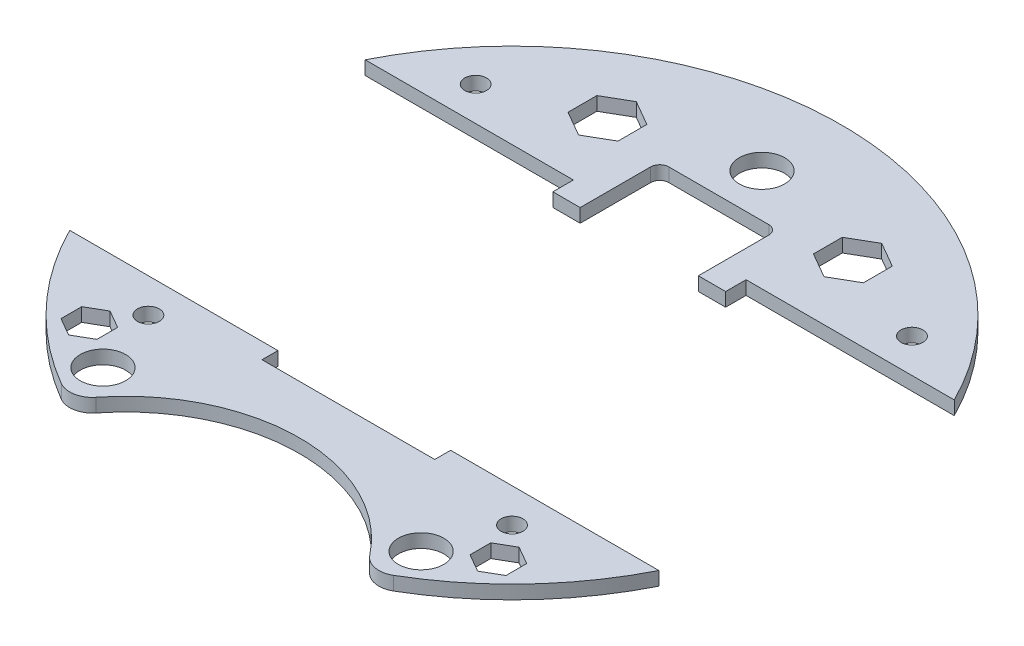
from build123d import *

# Parameters (mm, degrees)
BOSS_EXTRUDE1_DEPTH  = 3
SOLENOID_PLACEMENT_W = 38
SOLENOID_PLACEMENT_H = 64
CUT_EXTRUDE1_DEPTH   = 103.574363269
CUT_EXTRUDE5_DEPTH   = 103.574363269
SKETCH6_R            = 2.4
CUT_EXTRUDE6_DEPTH   = 103.574363269
CUT_EXTRUDE3_DEPTH   = 103.574363269
CUT_EXTRUDE7_DEPTH   = 98.289516393
SKETCH8_R            = 5
CUT_EXTRUDE9_DEPTH   = 98.289516393
SKETCH9_R            = 5
CUT_EXTRUDE11_DEPTH  = 98.289516393
CUT_EXTRUDE12_DEPTH  = 98.289516393


with BuildPart() as part:
    # Sketch1 → Boss-Extrude1 (new body)
    with BuildSketch(Plane(origin=(0, 0, 0), x_dir=(1, 0, 0), z_dir=(0, 1, 0))):
        with BuildLine():
            ThreePointArc((36.543377003, -62.616544118), (0, 72.5), (-36.543377003, -62.616544118))
            ThreePointArc((-36.543377003, -62.616544118), (-33.085954668, -63.20954405), (-30.089832649, -61.38507948))
            ThreePointArc((-30.089832649, -61.38507948), (0, -46.75), (30.089832649, -61.38507948))
            ThreePointArc((30.089832649, -61.38507948), (33.085954668, -63.20954405), (36.543377003, -62.616544118))
        make_face()
    extrude(amount=BOSS_EXTRUDE1_DEPTH)

    # solenoid placement → Cut-Extrude1 (cut, through all)
    with BuildSketch(Plane(origin=(0, 3, 0), x_dir=(1, 0, 0), z_dir=(0, 1, 0))):
        with Locations((0, -4)):
            Rectangle(SOLENOID_PLACEMENT_W, SOLENOID_PLACEMENT_H)
    extrude(amount=-CUT_EXTRUDE1_DEPTH, mode=Mode.SUBTRACT)

    # Sketch5 → Cut-Extrude5 (cut, through all)
    with BuildSketch(Plane(origin=(0, 3, 0), x_dir=(1, 0, 0), z_dir=(0, 1, 0))):
        Polygon((-21.5, 51.175426481), (-27, 54.350852961), (-32.5, 51.175426481), (-32.5, 44.824573519), (-27, 41.649147039), (-21.5, 44.824573519), align=None)
        Polygon((21.5, 51.175426481), (21.5, 44.824573519), (27, 41.649147039), (32.5, 44.824573519), (32.5, 51.175426481), (27, 54.350852961), align=None)
    extrude(amount=-CUT_EXTRUDE5_DEPTH, mode=Mode.SUBTRACT)

    # Sketch6 → Cut-Extrude6 (cut, through all)
    with BuildSketch(Plane(origin=(0, 3, 0), x_dir=(1, 0, 0), z_dir=(0, 1, 0))):
        with Locations((40, -40)):
            Circle(SKETCH6_R)
        with Locations((-40, -40)):
            Circle(SKETCH6_R)
        with Locations((48, 40)):
            Circle(SKETCH6_R)
        with Locations((-48, 40)):
            Circle(SKETCH6_R)
    extrude(amount=-CUT_EXTRUDE6_DEPTH, mode=Mode.SUBTRACT)

    # Sketch3 → Cut-Extrude3 (cut, through all)
    with BuildSketch(Plane(origin=(0, 3, 0), x_dir=(1, 0, 0), z_dir=(0, 1, 0))):
        Polygon((-19, 28), (-19, 32.5), (-72.5, 32.5), (-72.5, -32.5), (72.5, -32.5), (72.5, 32.5), (19, 32.5), (19, 28), align=None)
    extrude(amount=-CUT_EXTRUDE3_DEPTH, mode=Mode.SUBTRACT)


with BuildPart() as cut_extrude3_piece_1:
    # of the separate pieces the step leaves, piece 1, a body of its own (cut_extrude3_pieces)
    add(part.part.solids().sort_by_distance((64.807406984, 0, -32.5))[0])

    # Sketch7 → Cut-Extrude7 (cut, through all)
    with BuildSketch(Plane(origin=(0, 3, 0), x_dir=(1, 0, 0), z_dir=(0, 1, 0))):
        with BuildLine():
            Line((13, 28), (13, 43.5))
            ThreePointArc((13, 43.5), (12.414213562, 44.914213562), (11, 45.5))
            Line((11, 45.5), (-11, 45.5))
            ThreePointArc((-11, 45.5), (-12.414213562, 44.914213562), (-13, 43.5))
            Line((-13, 43.5), (-13, 28))
            Line((-13, 28), (13, 28))
        make_face()
    extrude(amount=-CUT_EXTRUDE7_DEPTH, mode=Mode.SUBTRACT)

    # Sketch9 → Cut-Extrude11 (cut, through all)
    with BuildSketch(Plane.XZ.offset(-3)):
        with Locations((0, -55)):
            Circle(SKETCH9_R)
    extrude(amount=CUT_EXTRUDE11_DEPTH, mode=Mode.SUBTRACT)


with BuildPart() as cut_extrude3_piece_2:
    # of the separate pieces the step leaves, piece 2, a body of its own (cut_extrude3_pieces)
    add(part.part.solids().sort_by_distance((-36.543377003, 0, 62.616544118))[0])

    # Sketch8 → Cut-Extrude9 (cut, through all)
    with BuildSketch(Plane.XZ.offset(-3)):
        with Locations((35, 55)):
            Circle(SKETCH8_R)
        with Locations((-35, 55)):
            Circle(SKETCH8_R)
    extrude(amount=CUT_EXTRUDE9_DEPTH, mode=Mode.SUBTRACT)

    # Sketch10 → Cut-Extrude12 (cut, through all)
    with BuildSketch(Plane(origin=(0, 3, 0), x_dir=(1, 0, 0), z_dir=(0, 1, 0))):
        Polygon((48.95, -45.719466437), (45, -43.438932873), (41.05, -45.719466437), (41.05, -50.280533563), (45, -52.561067127), (48.95, -50.280533563), align=None)
        Polygon((-48.95, -50.280533563), (-48.95, -45.719466437), (-45, -43.438932873), (-41.05, -45.719466437), (-41.05, -50.280533563), (-45, -52.561067127), align=None)
    extrude(amount=-CUT_EXTRUDE12_DEPTH, mode=Mode.SUBTRACT)


solid = Compound([cut_extrude3_piece_1.part, cut_extrude3_piece_2.part])
